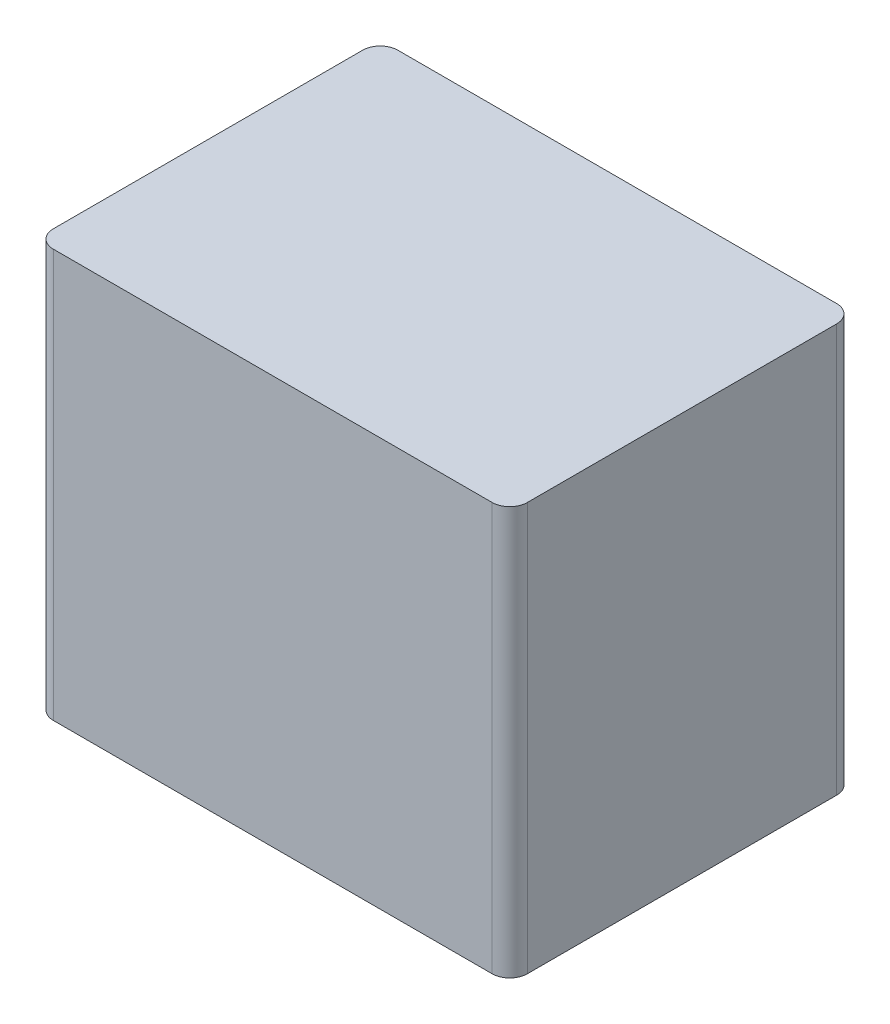
from build123d import *

# Parameters (mm, degrees)
SKETCH1_W              = 54
SKETCH1_H              = 39.25
BOSS_EXTRUDE1_DEPTH    = 46.5
FILLET1_R              = 2
FILLET2_R              = 2
Z_95_START             = -0.023652431
Z_95_BLANK_DEPTH       = 10
Z_95_START_2           = -5.023652431
Z_95_BLANK_2_OUTLINE_R = 2.5
Z_95_BLANK_2_DEPTH     = 5
BODY_MOVE_COPY3_ANGLE  = 180
BODY_MOVE_COPY4_ANGLE  = 89.5


with BuildPart() as part:
    # Sketch1 → Boss-Extrude1 (new body)
    with BuildSketch(Plane(origin=(0, 0, 0), x_dir=(1, 0, 0), z_dir=(0, 1, 0))):
        with Locations((27, 19.625)):
            Rectangle(SKETCH1_W, SKETCH1_H)
    extrude(amount=BOSS_EXTRUDE1_DEPTH)

    # Fillet1
    fillet1_edges = [part.edges().sort_by_distance(p)[0] for p in [
        (0, 23.25, 0),
    ]]
    fillet(fillet1_edges, radius=FILLET1_R)

    # Fillet2
    fillet2_edges = [part.edges().sort_by_distance(p)[0] for p in [
        (0, 23.25, -39.25),
        (54, 23.25, -39.25),
        (54, 23.25, 0),
    ]]
    fillet(fillet2_edges, radius=FILLET2_R)


with BuildPart() as body_2:
    # Z-95 Blank: read off the stored shape, not the designer's step
    # Z-95 Blank outline → Z-95 Blank (new body)
    with BuildSketch(Plane(origin=(0, 0, 0), x_dir=(1, 0, 0), z_dir=(0, 1, 0)).offset(Z_95_START)):
        Polygon((-39.475833264, 51.689675598), (-39.475833264, 48.062948495), (-51.475833264, 46.678320586), (-51.475833264, 23.139646129), (-47.225833264, 23.139646129), (-47.225833264, 35.139646129), (-37.225833264, 35.139646129), (-35.725833264, 5.689675598), (-31.225833264, 5.689675598), (-29.725833264, 35.139646129), (-19.725833264, 35.139646129), (-19.725833264, 23.139646129), (-15.475833264, 23.139646129), (-15.475833264, 46.678320586), (-27.475833264, 48.062948495), (-27.475833264, 51.689675598), align=None)
    extrude(amount=Z_95_BLANK_DEPTH)

    # Z-95 Blank 2 outline → Z-95 Blank 2 (add)
    with BuildSketch(Plane(origin=(0, 0, 0), x_dir=(1, 0, 0), z_dir=(0, 1, 0)).offset(Z_95_START_2)):
        with Locations((-33.475833264, 34.343753809)):
            Circle(Z_95_BLANK_2_OUTLINE_R)
    extrude(amount=Z_95_BLANK_2_DEPTH)


with BuildPart() as body_2_1:
    # Body-Move/Copy3: moved
    add(body_2.part.rotate(Axis((0, 2.476347569, -28.689675598), (1, 0, 0)), BODY_MOVE_COPY3_ANGLE))


with BuildPart() as body_2_2:
    # Body-Move/Copy4: moved
    add(body_2_1.part.rotate(Axis((-33.475833264, 0, -28.689675598), (0, -1, 0)), BODY_MOVE_COPY4_ANGLE))


with BuildPart() as body_2_3:
    # Body-Move/Copy5: moved
    add(body_2_2.part.moved(Location((61.536777905, 5.06338101, 8.948981511))))


with BuildPart() as body_2_4:
    # Body-Move/Copy6: moved
    add(body_2_3.part.moved(Location((0, -0.229742035, 0))))


with BuildPart() as part_1:
    add(part.part)

    # Intersect1: read off the stored shape, not the designer's step
    # Intersect1: cut body 2
    add(body_2_4.part, mode=Mode.SUBTRACT)


solid = part_1.part
